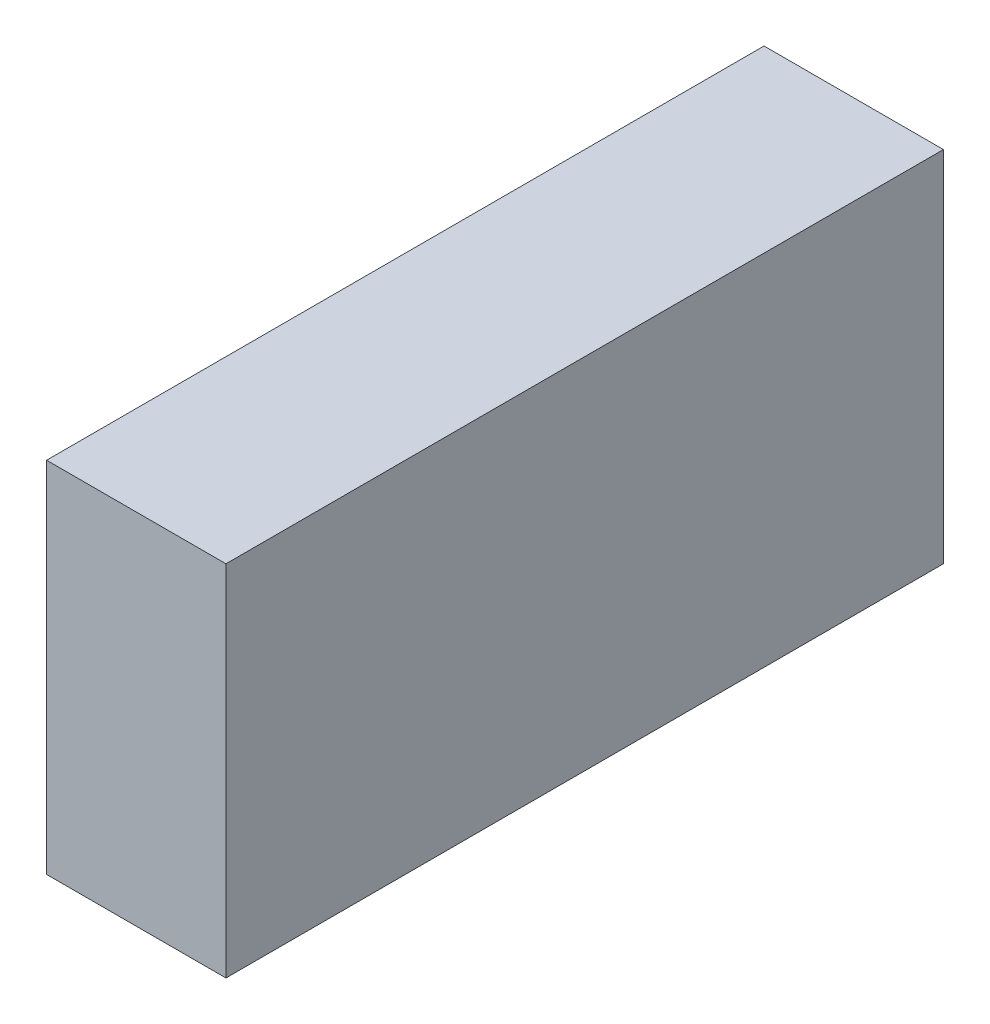
from build123d import *

# Parameters (mm, degrees)
SKETCH1_W           = 40
SKETCH1_H           = 20
BOSS_EXTRUDE1_DEPTH = 10


with BuildPart() as part:
    # Sketch1 → Boss-Extrude1 (new body)
    with BuildSketch(Plane(origin=(0, 0, 0), x_dir=(0, 0, -1), z_dir=(1, 0, 0))):
        with Locations((20, 10)):
            Rectangle(SKETCH1_W, SKETCH1_H)
    extrude(amount=-BOSS_EXTRUDE1_DEPTH)


solid = part.part
